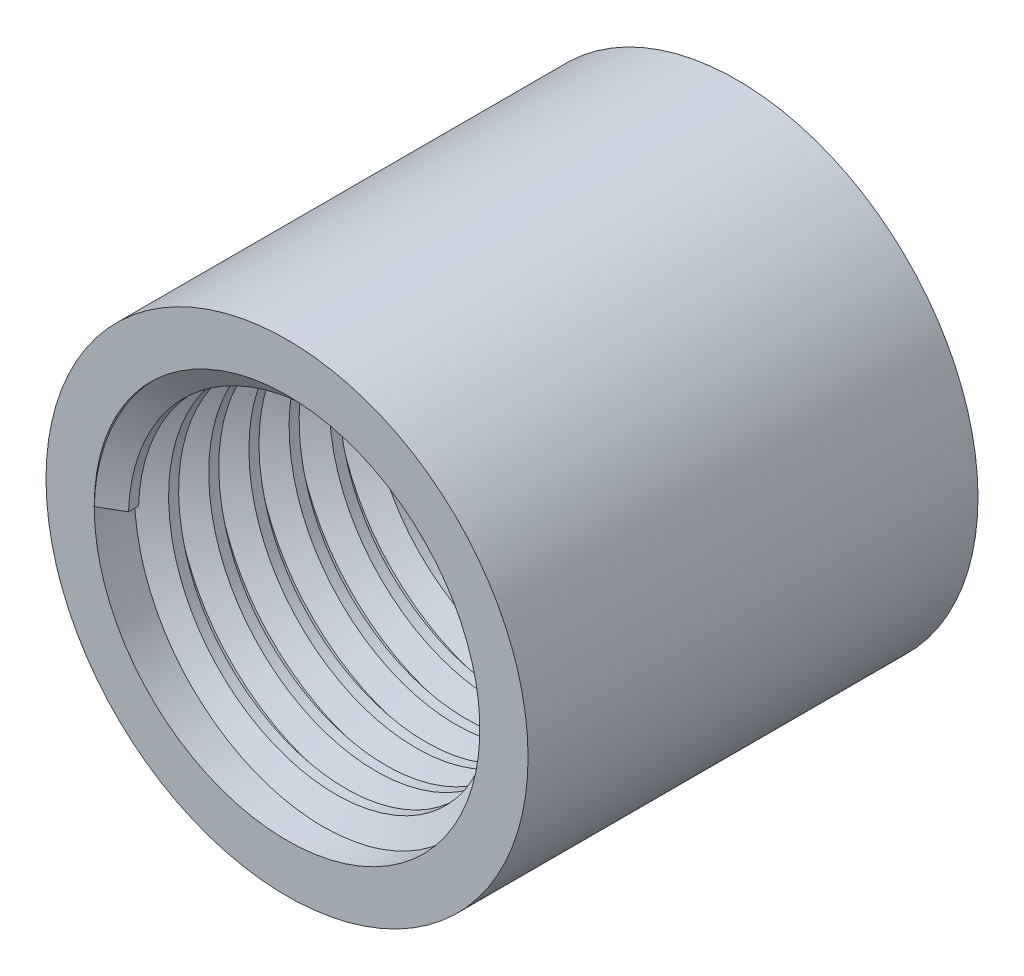
from build123d import *
from build123d.topology import SkipClean

# Parameters (mm, degrees)
SKETCH1_R                  = 7.5
BOSS_EXTRUDE1_DEPTH        = 7
F_10_0MM_DOWEL_HOLE1_D     = 10
F_10_0MM_DOWEL_HOLE1_DEPTH = 10
F_10_0MM_DOWEL_HOLE1_TIP   = 3.004303095
SKETCH12_R                 = 6
CUT_EXTRUDE1_DEPTH         = 8
THREAD1_PITCH              = 1.25


with BuildPart() as part:
    # Sketch1 → Boss-Extrude1 (new, symmetric)
    with BuildSketch(Plane.XY):
        Circle(SKETCH1_R)
    extrude(amount=BOSS_EXTRUDE1_DEPTH, both=True)

    # Ø10.0mm Dowel Hole1
    with Locations(Plane(origin=(0, -0.010331919, 7), x_dir=(1, 0, 0), z_dir=(0, 0, 1))):
        with Locations((0, 0)):
            Hole(F_10_0MM_DOWEL_HOLE1_D / 2, depth=F_10_0MM_DOWEL_HOLE1_DEPTH)
            with Locations((0, 0, -(F_10_0MM_DOWEL_HOLE1_DEPTH + F_10_0MM_DOWEL_HOLE1_TIP / 2))):  # 118° drill point
                Cone(0, F_10_0MM_DOWEL_HOLE1_D / 2, F_10_0MM_DOWEL_HOLE1_TIP, mode=Mode.SUBTRACT)

    # Sketch12 → Cut-Extrude1 (cut)
    with BuildSketch(Plane.XY.offset(7)):
        Circle(SKETCH12_R)
    extrude(amount=-CUT_EXTRUDE1_DEPTH, mode=Mode.SUBTRACT)

    # Thread1: the profile of Thread Profile3 profile screwed along a right-hand helix of 6.4 turns, 8 arcs to a turn; built about Z, then put on its axis
    with SkipClean():  # the faces are left unmerged after this step: merging them gives an invalid solid
        thread1_z = Axis((0, 0, 0), (0, 0, 1))
        thread1_corners = [(6.0003, 0, -0.000173205), (6.0003, 0, 1.093923202), (5.323417656, 0, 0.703124998), (5.323417656, 0, 0.390624998)]
        with BuildLine(mode=Mode.PRIVATE) as thread1_profile:
            Line(thread1_corners[0], thread1_corners[1])
            Line(thread1_corners[1], thread1_corners[2])
            Line(thread1_corners[2], thread1_corners[3])
            Line(thread1_corners[3], thread1_corners[0])
        thread1_cap = Face(thread1_profile.wire())
        thread1_turn_angles = [0, 22.5, 45, 67.5, 90, 112.5, 135, 157.5, 180, 202.5, 225, 247.5, 270, 292.5, 315, 337.5, 360]
        thread1_turn_weights = [1, 0.9238795325112867, 1, 0.9238795325112867, 1, 0.9238795325112867, 1, 0.9238795325112867, 1, 0.9238795325112867, 1, 0.9238795325112867, 1, 0.9238795325112867, 1, 0.9238795325112867, 1]
        thread1_turn_rails = [Edge.make_bspline([Vector(p[0], p[1], 0).rotate(thread1_z, thread1_turn_angles[k]) / thread1_turn_weights[k] + Vector(0, 0, p[2] + THREAD1_PITCH * thread1_turn_angles[k] / 360) for k in range(17)], [0, 0, 0, 1, 1, 2, 2, 3, 3, 4, 4, 5, 5, 6, 6, 7, 7, 8, 8, 8], 2, thread1_turn_weights) for p in thread1_corners]
        thread1_turn_sides = [Face.make_surface_from_curves(thread1_turn_rails[p[0]], thread1_turn_rails[p[1]]) for p in [(0, 1), (1, 2), (2, 3), (3, 0)]]
        thread1_last_angles = [2160, 2182.5, 2205, 2227.5, 2250, 2272.5, 2295, 2299.5, 2304]
        thread1_last_weights = [1, 0.9238795325112867, 1, 0.9238795325112867, 1, 0.9238795325112867, 1, 0.996917333733128, 1]
        thread1_last_rails = [Edge.make_bspline([Vector(p[0], p[1], 0).rotate(thread1_z, thread1_last_angles[k]) / thread1_last_weights[k] + Vector(0, 0, p[2] + THREAD1_PITCH * thread1_last_angles[k] / 360) for k in range(9)], [0, 0, 0, 1, 1, 2, 2, 3, 3, 4, 4, 4], 2, thread1_last_weights) for p in thread1_corners]
        thread1_last_sides = [Face.make_surface_from_curves(thread1_last_rails[p[0]], thread1_last_rails[p[1]]) for p in [(0, 1), (1, 2), (2, 3), (3, 0)]]
        thread1 = Plane(origin=(0, 0, 7), x_dir=(-1, 0, 0), z_dir=(0, 0, -1)) * Solid(Shell([*[p.moved(Location((0, 0, THREAD1_PITCH * i))) for i in range(6) for p in thread1_turn_sides], *thread1_last_sides, thread1_cap, thread1_cap.rotate(thread1_z, 2304).moved(Location((0, 0, THREAD1_PITCH * 2304 / 360)))]))
        add(thread1)


solid = part.part
